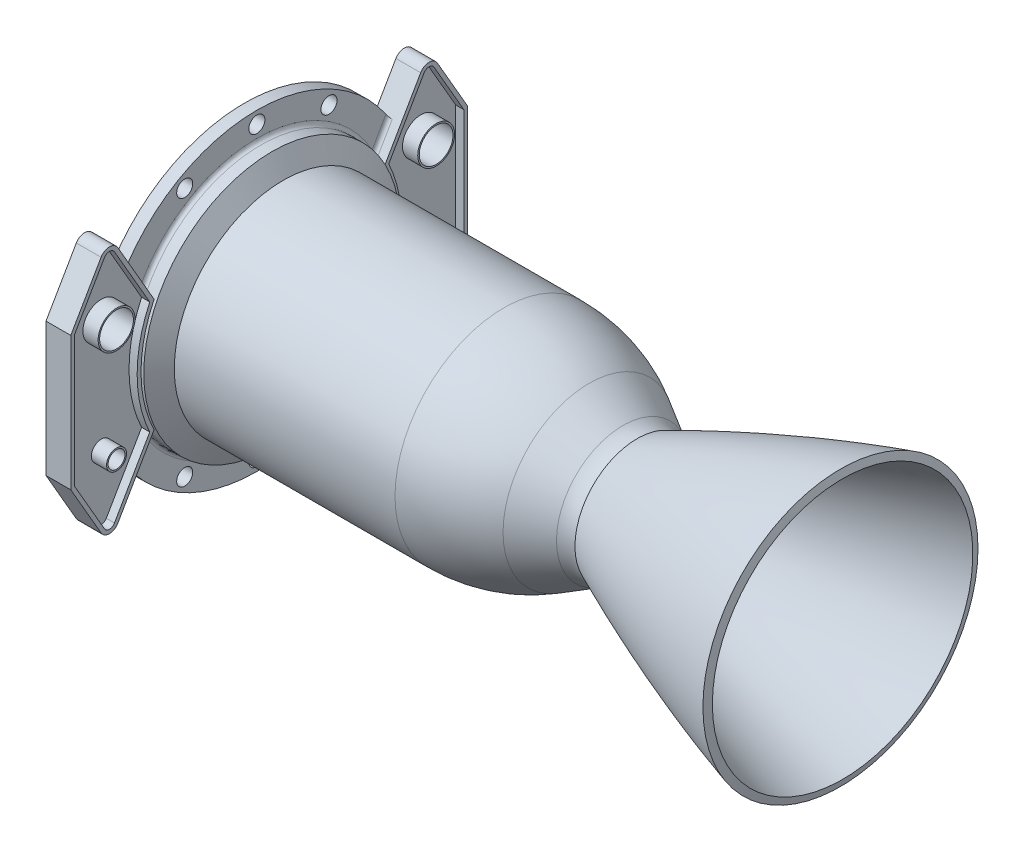
from build123d import *
from build123d.topology import SkipClean

# Parameters (mm, degrees)
BOSS_EXTRUDE1_DEPTH = 16.256
CUT_EXTRUDE1_DEPTH  = 5.334
BOSS_EXTRUDE2_START = -8.128
BOSS_EXTRUDE2_DEPTH = 8.128
FILLET2_R           = 2.54
SKETCH9_R           = 5.275
CUT_EXTRUDE2_DEPTH  = 419.885269444
SKETCH10_R          = 11.1
SKETCH10_R_2        = 5.55
CUT_EXTRUDE3_DEPTH  = 417.321354466
BOSS_EXTRUDE3_START = 10
SKETCH11_R          = 12.1
SKETCH11_R_2        = 11.1
SKETCH11_R_3        = 6.55
SKETCH11_R_4        = 5.55
BOSS_EXTRUDE3_DEPTH = 10


with BuildPart() as part:
    # Sketch3 → Revolve1 (revolve)
    with BuildSketch(Plane.XY):
        with BuildLine():
            Line((0, 71.5011717), (144.934666475, 71.5011717))
            ThreePointArc((144.934666475, 71.5011717), (173.892574508, 67.688769671), (200.877042723, 56.51141211))
            Line((200.877042723, 56.51141211), (223.127154881, 43.665279514))
            ThreePointArc((223.127154881, 43.665279514), (227.625034583, 41.721337074), (232.448772375, 40.860298318))
            add(Edge.make_bspline(
                [(232.448772375, 40.860298318), (234.86856203, 41.933657894), (240.173238318, 44.266655644), (251.176182965, 49.013937562), (265.440009786, 54.97345202), (282.448229164, 61.765962568), (299.354503113, 68.202057856), (316.156963457, 74.280596731), (332.857651733, 80.001884245), (346.685594207, 84.470267584), (357.704525634, 87.868146407), (363.182392167, 89.503083437), (365.9308663, 90.309661005)],
                knots=[0.492875979, 0.492875979, 0.492875979, 0.492875979, 0.492966882, 0.493074775, 0.493290561, 0.493506346, 0.493722132, 0.493937918, 0.494153704, 0.494369489, 0.494477382, 0.494585275, 0.494585275, 0.494585275, 0.494585275], degree=3))
            Line((365.9308663, 90.309661005), (367.338810321, 85.511985147))
            add(Edge.make_bspline(
                [(233.424633311, 35.822756061), (236.183141196, 37.049408729), (241.820242455, 39.531718175), (253.12775411, 44.410404122), (267.331680592, 50.344882311), (284.265598042, 57.10770533), (301.095145103, 63.51457761), (317.818383555, 69.564442688), (334.43732724, 75.257710839), (348.19495997, 79.703362784), (359.156425704, 83.083517043), (364.604957844, 84.709698506), (367.338810321, 85.511985147)],
                knots=[0.492862754, 0.492862754, 0.492862754, 0.492862754, 0.492966882, 0.493074775, 0.493290561, 0.493506346, 0.493722132, 0.493937918, 0.494153704, 0.494369489, 0.494477382, 0.494585275, 0.494585275, 0.494585275, 0.494585275], degree=3))
            ThreePointArc((233.424633311, 35.822756061), (226.800103593, 36.756276843), (220.627157517, 39.335150973))
            Line((220.627157517, 39.335150973), (198.377039169, 52.181287144))
            ThreePointArc((198.377039169, 52.181287144), (172.598474463, 62.859141831), (144.9346606, 66.5011717))
            Line((144.9346606, 66.5011717), (0, 66.5011717))
            Line((0, 66.5011717), (0, 71.5011717))
        make_face()
    revolve(axis=Axis((0, 0, 0), (1, 0, 0)))

    # Sketch4 → Revolve5 (revolve)
    with BuildSketch(Plane.XY):
        Polygon((-25.4, 66.5011717), (-25.4, 84.2011717), (-7.332348419, 84.2011717), (0, 71.5011717), (0, 66.5011717), align=None)
    revolve(axis=Axis((0, 0, 0), (1, 0, 0)))

    # Sketch6 → Boss-Extrude1 (add)
    with SkipClean():  # the faces are left unmerged after this step: merging them gives an invalid solid
        with BuildSketch(Plane.ZY.offset(25.4)):
            with BuildLine():
                Line((64.197098299, 17.35333995), (99.428641487, 78.37616278))
                ThreePointArc((99.428641487, 78.37616278), (104.927902801, 81.55116278), (110.427164115, 78.37616278))
                Line((110.427164115, 78.37616278), (130.327902801, 43.907072268))
                Line((130.327902801, 43.907072268), (130.327902801, -43.907072268))
                Line((130.327902801, -43.907072268), (110.427164115, -78.37616278))
                ThreePointArc((110.427164115, -78.37616278), (104.927902801, -81.55116278), (99.428641487, -78.37616278))
                Line((99.428641487, -78.37616278), (64.197098299, -17.35333995))
                ThreePointArc((64.197098299, -17.35333995), (66.5011717, 0), (64.197098299, 17.35333995))
            make_face()
            with BuildLine():
                Line((-64.197098299, -17.35333995), (-99.428641487, -78.37616278))
                ThreePointArc((-99.428641487, -78.37616278), (-104.927902801, -81.55116278), (-110.427164115, -78.37616278))
                Line((-110.427164115, -78.37616278), (-130.327902801, -43.907072268))
                Line((-130.327902801, -43.907072268), (-130.327902801, 43.907072268))
                Line((-130.327902801, 43.907072268), (-110.427164115, 78.37616278))
                ThreePointArc((-110.427164115, 78.37616278), (-104.927902801, 81.55116278), (-99.428641487, 78.37616278))
                Line((-99.428641487, 78.37616278), (-64.197098299, 17.35333995))
                ThreePointArc((-64.197098299, 17.35333995), (-66.5011717, 0), (-64.197098299, -17.35333995))
            make_face()
        extrude(amount=-BOSS_EXTRUDE1_DEPTH)

    # Sketch7 → Cut-Extrude1 (cut)
    with SkipClean():  # the faces are left unmerged after this step: merging them gives an invalid solid
        with BuildSketch(Plane(origin=(-9.144, 0, 0), x_dir=(0, 0, -1), z_dir=(1, 0, 0))):
            with BuildLine():
                Line((-78.462562562, 36.981848846), (-101.628346013, 77.10616278))
                ThreePointArc((-101.628346013, 77.10616278), (-104.927902801, 79.01116278), (-108.22745959, 77.10616278))
                Line((-108.22745959, 77.10616278), (-127.787902801, 43.226481319))
                Line((-127.787902801, 43.226481319), (-127.787902801, -43.226481319))
                Line((-127.787902801, -43.226481319), (-108.22745959, -77.10616278))
                ThreePointArc((-108.22745959, -77.10616278), (-104.927902801, -79.01116278), (-101.628346013, -77.10616278))
                Line((-101.628346013, -77.10616278), (-78.462562562, -36.981848846))
                ThreePointArc((-78.462562562, -36.981848846), (-86.7411717, 0), (-78.462562562, 36.981848846))
            make_face()
            with BuildLine():
                Line((101.628346013, -77.10616278), (78.462562562, -36.981848846))
                ThreePointArc((78.462562562, -36.981848846), (86.7411717, 0), (78.462562562, 36.981848846))
                Line((78.462562562, 36.981848846), (101.628346013, 77.10616278))
                ThreePointArc((101.628346013, 77.10616278), (104.927902801, 79.01116278), (108.22745959, 77.10616278))
                Line((108.22745959, 77.10616278), (127.787902801, 43.226481319))
                Line((127.787902801, 43.226481319), (127.787902801, -43.226481319))
                Line((127.787902801, -43.226481319), (108.22745959, -77.10616278))
                ThreePointArc((108.22745959, -77.10616278), (104.927902801, -79.01116278), (101.628346013, -77.10616278))
            make_face()
        extrude(amount=-CUT_EXTRUDE1_DEPTH, mode=Mode.SUBTRACT)

    # Sketch8 → Boss-Extrude2 (add)
    with SkipClean():  # the faces are left unmerged after this step: merging them gives an invalid solid
        with BuildSketch(Plane.ZY.offset(25.4).offset(BOSS_EXTRUDE2_START)):
            with BuildLine():
                Line((-75.592096587, 37.090055935), (-86.329826389, 55.688349511))
                ThreePointArc((-86.329826389, 55.688349511), (0, 102.7328146), (86.329826389, 55.688349511))
                Line((86.329826389, 55.688349511), (75.592096587, 37.090055935))
                ThreePointArc((75.592096587, 37.090055935), (0, 84.2011717), (-75.592096587, 37.090055935))
            make_face()
            with BuildLine():
                Line((86.329826389, -55.688349511), (75.592096587, -37.090055935))
                ThreePointArc((75.592096587, -37.090055935), (0, -84.2011717), (-75.592096587, -37.090055935))
                Line((-75.592096587, -37.090055935), (-86.329826389, -55.688349511))
                ThreePointArc((-86.329826389, -55.688349511), (0, -102.7328146), (86.329826389, -55.688349511))
            make_face()
        extrude(amount=BOSS_EXTRUDE2_DEPTH)

    # Fillet2
    fillet2_edges = [part.edges().sort_by_distance(p)[0] for p in [
        (-17.272, 46.389202723, 80.960961488),
        (-17.272, 71.459301297, 44.535441771),
        (-17.272, 46.389202723, -80.960961488),
        (-17.272, -46.389202723, -80.960961488),
        (-17.272, -84.2011717, 0),
        (-17.272, -46.389202723, 80.960961488),
    ]]
    fillet(fillet2_edges, radius=FILLET2_R)

    # Sketch9 → Cut-Extrude2 (cut, through all)
    with SkipClean():  # the faces are left unmerged after this step: merging them gives an invalid solid
        with BuildSketch(Plane(origin=(-17.272, 0, 0), x_dir=(0, 0, -1), z_dir=(1, 0, 0))):
            with Locations((0, 94.73699315)):
                Circle(SKETCH9_R)
            with Locations((-47.368496575, 82.044642746)):
                Circle(SKETCH9_R)
            with Locations((47.368496575, 82.044642746)):
                Circle(SKETCH9_R)
            with Locations((47.368496575, -82.044642746)):
                Circle(SKETCH9_R)
            with Locations((0, -94.73699315)):
                Circle(SKETCH9_R)
            with Locations((-47.368496575, -82.044642746)):
                Circle(SKETCH9_R)
        extrude(amount=-CUT_EXTRUDE2_DEPTH, mode=Mode.SUBTRACT)

    # Sketch10 → Cut-Extrude3 (cut, through all)
    with SkipClean():  # the faces are left unmerged after this step: merging them gives an invalid solid
        with BuildSketch(Plane(origin=(-14.478, 0, 0), x_dir=(0, 0, -1), z_dir=(1, 0, 0))):
            with Locations((-104.927902801, 36.981848846)):
                Circle(SKETCH10_R)
            with Locations((-104.927902801, -36.981848846)):
                Circle(SKETCH10_R_2)
            with Locations((104.927902801, -36.981848846)):
                Circle(SKETCH10_R_2)
            with Locations((104.927902801, 36.981848846)):
                Circle(SKETCH10_R)
        extrude(amount=-CUT_EXTRUDE3_DEPTH, mode=Mode.SUBTRACT)

    # Sketch11 → Boss-Extrude3 (add)
    # profile 1 of 4: a face of its own
    with SkipClean():  # the faces are left unmerged after this step: merging them gives an invalid solid
        with BuildSketch(Plane(origin=(-14.478, 0, 0), x_dir=(0, 0, -1), z_dir=(1, 0, 0)).offset(BOSS_EXTRUDE3_START)):
            with Locations((-104.927902801, 36.981848846)):
                Circle(SKETCH11_R)
            with Locations((-104.927902801, 36.981848846)):
                Circle(SKETCH11_R_2, mode=Mode.SUBTRACT)
        # profile 2 of 4: a face of its own
        with BuildSketch(Plane(origin=(-14.478, 0, 0), x_dir=(0, 0, -1), z_dir=(1, 0, 0)).offset(BOSS_EXTRUDE3_START)):
            with Locations((-104.927902801, -36.981848846)):
                Circle(SKETCH11_R_3)
            with Locations((-104.927902801, -36.981848846)):
                Circle(SKETCH11_R_4, mode=Mode.SUBTRACT)
        # profile 3 of 4: a face of its own
        with BuildSketch(Plane(origin=(-14.478, 0, 0), x_dir=(0, 0, -1), z_dir=(1, 0, 0)).offset(BOSS_EXTRUDE3_START)):
            with Locations((104.927902801, -36.981848846)):
                Circle(SKETCH11_R_3)
            with Locations((104.927902801, -36.981848846)):
                Circle(SKETCH11_R_4, mode=Mode.SUBTRACT)
        # profile 4 of 4: a face of its own
        with BuildSketch(Plane(origin=(-14.478, 0, 0), x_dir=(0, 0, -1), z_dir=(1, 0, 0)).offset(BOSS_EXTRUDE3_START)):
            with Locations((104.927902801, 36.981848846)):
                Circle(SKETCH11_R)
            with Locations((104.927902801, 36.981848846)):
                Circle(SKETCH11_R_2, mode=Mode.SUBTRACT)
        extrude(amount=-BOSS_EXTRUDE3_DEPTH)


solid = part.part
